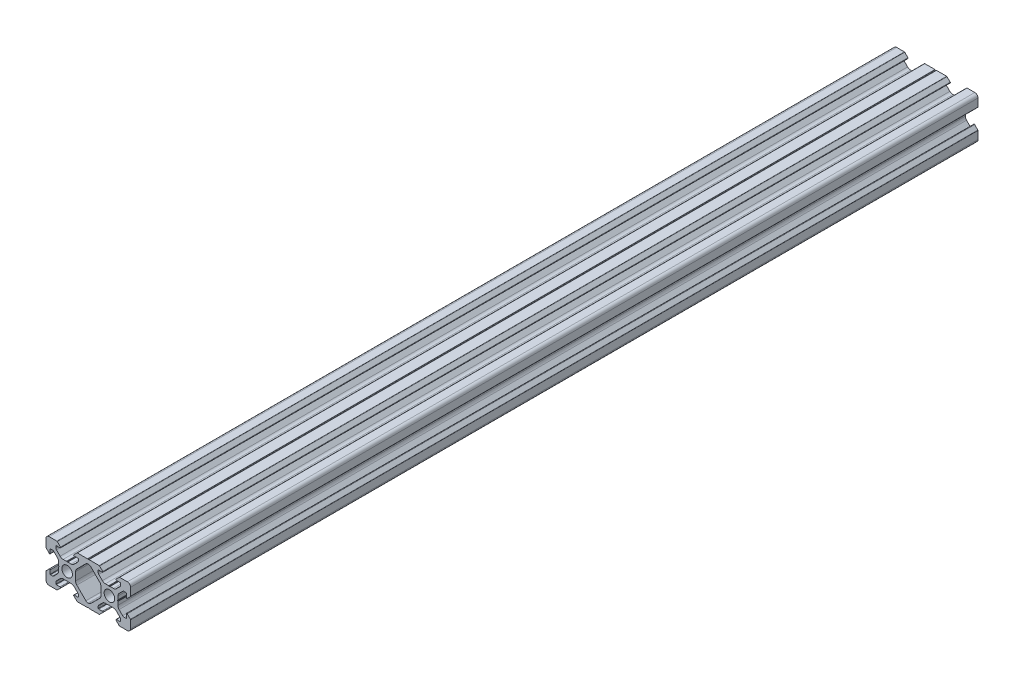
from build123d import *

# Parameters (mm, degrees)
MODEL_R                         = 2.5
BODY_DEPTH                      = 401
TAP_DRILL_FOR_M6X1_0_TAP1_D     = 5
TAP_DRILL_FOR_M6X1_0_TAP1_DEPTH = 13.497848452
TAP_DRILL_FOR_M6X1_0_TAP1_TIP   = 1.502151548
TAP_DRILL_FOR_M6X1_0_TAP2_D     = 5
TAP_DRILL_FOR_M6X1_0_TAP2_DEPTH = 13.497848452
TAP_DRILL_FOR_M6X1_0_TAP2_TIP   = 1.502151548


with BuildPart() as part:
    # Model → Body (new body)
    with BuildSketch(Plane.XY):
        with BuildLine():
            Line((0.375693909, 9.662304735), (5.17, 9.662304735))
            ThreePointArc((5.17, 9.662304735), (5.265670858, 9.643274618), (5.346776695, 9.58908143))
            Line((5.346776695, 9.58908143), (6.846776695, 8.08908143))
            ThreePointArc((6.846776695, 8.08908143), (6.900969883, 7.816633877), (6.67, 7.662304735))
            Line((6.67, 7.662304735), (4.9, 7.662304735))
            ThreePointArc((4.9, 7.662304735), (4.758578644, 7.603726091), (4.7, 7.462304735))
            Line((4.7, 7.462304735), (4.7, 6.649310504))
            ThreePointArc((4.7, 6.649310504), (4.776120467, 6.266627071), (4.992893219, 5.942203722))
            Line((4.992893219, 5.942203722), (6.687005769, 4.248091173))
            ThreePointArc((6.687005769, 4.248091173), (7.335852466, 3.81454567), (8.101219331, 3.662304735))
            Line((8.101219331, 3.662304735), (9.662304735, 3.662304735))
            ThreePointArc((9.662304735, 3.662304735), (9.745056471, 3.648211815), (9.818478497, 3.607521938))
            Line((9.818478497, 3.607521938), (10, 3.462304735))
            Line((10, 3.462304735), (10.181521503, 3.607521938))
            ThreePointArc((10.181521503, 3.607521938), (10.254943529, 3.648211815), (10.337695265, 3.662304735))
            Line((10.337695265, 3.662304735), (11.898780669, 3.662304735))
            ThreePointArc((11.898780669, 3.662304735), (12.664147534, 3.81454567), (13.312994231, 4.248091173))
            Line((13.312994231, 4.248091173), (15.007106781, 5.942203722))
            ThreePointArc((15.007106781, 5.942203722), (15.223879533, 6.266627071), (15.3, 6.649310504))
            Line((15.3, 6.649310504), (15.3, 7.462304735))
            ThreePointArc((15.3, 7.462304735), (15.241421356, 7.603726091), (15.1, 7.662304735))
            Line((15.1, 7.662304735), (13.33, 7.662304735))
            ThreePointArc((13.33, 7.662304735), (13.099030117, 7.816633877), (13.153223305, 8.08908143))
            Line((13.153223305, 8.08908143), (14.653223305, 9.58908143))
            ThreePointArc((14.653223305, 9.58908143), (14.734329142, 9.643274618), (14.83, 9.662304735))
            Line((14.83, 9.662304735), (18.5, 9.662304735))
            ThreePointArc((18.5, 9.662304735), (19.560660172, 9.222964907), (20, 8.162304735))
            Line((20, 8.162304735), (20, 4.492304735))
            ThreePointArc((20, 4.492304735), (19.980969883, 4.396633877), (19.926776695, 4.31552804))
            Line((19.926776695, 4.31552804), (18.426776695, 2.81552804))
            ThreePointArc((18.426776695, 2.81552804), (18.154329142, 2.761334852), (18, 2.992304735))
            Line((18, 2.992304735), (18, 4.762304735))
            ThreePointArc((18, 4.762304735), (17.941421356, 4.903726091), (17.8, 4.962304735))
            Line((17.8, 4.962304735), (16.987005769, 4.962304735))
            ThreePointArc((16.987005769, 4.962304735), (16.604322336, 4.886184268), (16.279898987, 4.669411516))
            Line((16.279898987, 4.669411516), (14.585786438, 2.975298967))
            ThreePointArc((14.585786438, 2.975298967), (14.152240935, 2.326452269), (14, 1.561085404))
            Line((14, 1.561085404), (14, 0))
            ThreePointArc((14, 0), (13.98590708, -0.082751735), (13.945217202, -0.156173762))
            Line((13.945217202, -0.156173762), (13.8, -0.337695265))
            Line((13.8, -0.337695265), (13.945217202, -0.519216768))
            ThreePointArc((13.945217202, -0.519216768), (13.98590708, -0.592638794), (14, -0.67539053))
            Line((14, -0.67539053), (14, -2.236475934))
            ThreePointArc((14, -2.236475934), (14.152240935, -3.001842799), (14.585786438, -3.650689496))
            Line((14.585786438, -3.650689496), (16.279898987, -5.344802046))
            ThreePointArc((16.279898987, -5.344802046), (16.604322336, -5.561574797), (16.987005769, -5.637695265))
            Line((16.987005769, -5.637695265), (17.8, -5.637695265))
            ThreePointArc((17.8, -5.637695265), (17.941421356, -5.579116621), (18, -5.437695265))
            Line((18, -5.437695265), (18, -3.667695265))
            ThreePointArc((18, -3.667695265), (18.154329142, -3.436725382), (18.426776695, -3.49091857))
            Line((18.426776695, -3.49091857), (19.926776695, -4.99091857))
            ThreePointArc((19.926776695, -4.99091857), (19.980969883, -5.072024407), (20, -5.167695265))
            Line((20, -5.167695265), (20, -8.837695265))
            ThreePointArc((20, -8.837695265), (19.560660172, -9.898355437), (18.5, -10.337695265))
            Line((18.5, -10.337695265), (14.83, -10.337695265))
            ThreePointArc((14.83, -10.337695265), (14.734329142, -10.318665148), (14.653223305, -10.26447196))
            Line((14.653223305, -10.26447196), (13.153223305, -8.76447196))
            ThreePointArc((13.153223305, -8.76447196), (13.099030117, -8.492024407), (13.33, -8.337695265))
            Line((13.33, -8.337695265), (15.1, -8.337695265))
            ThreePointArc((15.1, -8.337695265), (15.241421356, -8.279116621), (15.3, -8.137695265))
            Line((15.3, -8.137695265), (15.3, -7.324701033))
            ThreePointArc((15.3, -7.324701033), (15.223879533, -6.942017601), (15.007106781, -6.617594252))
            Line((15.007106781, -6.617594252), (13.312994231, -4.923481702))
            ThreePointArc((13.312994231, -4.923481702), (12.664147534, -4.4899362), (11.898780669, -4.337695265))
            Line((11.898780669, -4.337695265), (10.337695265, -4.337695265))
            ThreePointArc((10.337695265, -4.337695265), (10.254943529, -4.323602345), (10.181521503, -4.282912467))
            Line((10.181521503, -4.282912467), (10, -4.137695265))
            Line((10, -4.137695265), (9.818478497, -4.282912467))
            ThreePointArc((9.818478497, -4.282912467), (9.745056471, -4.323602345), (9.662304735, -4.337695265))
            Line((9.662304735, -4.337695265), (8.101219331, -4.337695265))
            ThreePointArc((8.101219331, -4.337695265), (7.335852466, -4.4899362), (6.687005769, -4.923481702))
            Line((6.687005769, -4.923481702), (4.992893219, -6.617594252))
            ThreePointArc((4.992893219, -6.617594252), (4.776120467, -6.942017601), (4.7, -7.324701033))
            Line((4.7, -7.324701033), (4.7, -8.137695265))
            ThreePointArc((4.7, -8.137695265), (4.758578644, -8.279116621), (4.9, -8.337695265))
            Line((4.9, -8.337695265), (6.67, -8.337695265))
            ThreePointArc((6.67, -8.337695265), (6.900969883, -8.492024407), (6.846776695, -8.76447196))
            Line((6.846776695, -8.76447196), (5.346776695, -10.26447196))
            ThreePointArc((5.346776695, -10.26447196), (5.265670858, -10.318665148), (5.17, -10.337695265))
            Line((5.17, -10.337695265), (0.375693909, -10.337695265))
            ThreePointArc((0.375693909, -10.337695265), (0.303247872, -10.326968271), (0.23701886, -10.295707838))
            Line((0.23701886, -10.295707838), (0, -10.137695265))
            Line((0, -10.137695265), (-0.23701886, -10.295707838))
            ThreePointArc((-0.23701886, -10.295707838), (-0.303247872, -10.326968271), (-0.375693909, -10.337695265))
            Line((-0.375693909, -10.337695265), (-5.17, -10.337695265))
            ThreePointArc((-5.17, -10.337695265), (-5.265670858, -10.318665148), (-5.346776695, -10.26447196))
            Line((-5.346776695, -10.26447196), (-6.846776695, -8.76447196))
            ThreePointArc((-6.846776695, -8.76447196), (-6.900969883, -8.492024407), (-6.67, -8.337695265))
            Line((-6.67, -8.337695265), (-4.9, -8.337695265))
            ThreePointArc((-4.9, -8.337695265), (-4.758578644, -8.279116621), (-4.7, -8.137695265))
            Line((-4.7, -8.137695265), (-4.7, -7.324701033))
            ThreePointArc((-4.7, -7.324701033), (-4.776120467, -6.942017601), (-4.992893219, -6.617594252))
            Line((-4.992893219, -6.617594252), (-6.687005769, -4.923481702))
            ThreePointArc((-6.687005769, -4.923481702), (-7.335852466, -4.4899362), (-8.101219331, -4.337695265))
            Line((-8.101219331, -4.337695265), (-9.662304735, -4.337695265))
            ThreePointArc((-9.662304735, -4.337695265), (-9.745056471, -4.323602345), (-9.818478497, -4.282912467))
            Line((-9.818478497, -4.282912467), (-10, -4.137695265))
            Line((-10, -4.137695265), (-10.181521503, -4.282912467))
            ThreePointArc((-10.181521503, -4.282912467), (-10.254943529, -4.323602345), (-10.337695265, -4.337695265))
            Line((-10.337695265, -4.337695265), (-11.898780669, -4.337695265))
            ThreePointArc((-11.898780669, -4.337695265), (-12.664147534, -4.4899362), (-13.312994231, -4.923481702))
            Line((-13.312994231, -4.923481702), (-15.007106781, -6.617594252))
            ThreePointArc((-15.007106781, -6.617594252), (-15.223879533, -6.942017601), (-15.3, -7.324701033))
            Line((-15.3, -7.324701033), (-15.3, -8.137695265))
            ThreePointArc((-15.3, -8.137695265), (-15.241421356, -8.279116621), (-15.1, -8.337695265))
            Line((-15.1, -8.337695265), (-13.33, -8.337695265))
            ThreePointArc((-13.33, -8.337695265), (-13.099030117, -8.492024407), (-13.153223305, -8.76447196))
            Line((-13.153223305, -8.76447196), (-14.653223305, -10.26447196))
            ThreePointArc((-14.653223305, -10.26447196), (-14.734329142, -10.318665148), (-14.83, -10.337695265))
            Line((-14.83, -10.337695265), (-18.5, -10.337695265))
            ThreePointArc((-18.5, -10.337695265), (-19.560660172, -9.898355437), (-20, -8.837695265))
            Line((-20, -8.837695265), (-20, -5.167695265))
            ThreePointArc((-20, -5.167695265), (-19.980969883, -5.072024407), (-19.926776695, -4.99091857))
            Line((-19.926776695, -4.99091857), (-18.426776695, -3.49091857))
            ThreePointArc((-18.426776695, -3.49091857), (-18.154329142, -3.436725382), (-18, -3.667695265))
            Line((-18, -3.667695265), (-18, -5.437695265))
            ThreePointArc((-18, -5.437695265), (-17.941421356, -5.579116621), (-17.8, -5.637695265))
            Line((-17.8, -5.637695265), (-16.987005769, -5.637695265))
            ThreePointArc((-16.987005769, -5.637695265), (-16.604322336, -5.561574797), (-16.279898987, -5.344802046))
            Line((-16.279898987, -5.344802046), (-14.585786438, -3.650689496))
            ThreePointArc((-14.585786438, -3.650689496), (-14.152240935, -3.001842799), (-14, -2.236475934))
            Line((-14, -2.236475934), (-14, -0.67539053))
            ThreePointArc((-14, -0.67539053), (-13.98590708, -0.592638794), (-13.945217202, -0.519216768))
            Line((-13.945217202, -0.519216768), (-13.8, -0.337695265))
            Line((-13.8, -0.337695265), (-13.945217202, -0.156173762))
            ThreePointArc((-13.945217202, -0.156173762), (-13.98590708, -0.082751735), (-14, 0))
            Line((-14, 0), (-14, 1.561085404))
            ThreePointArc((-14, 1.561085404), (-14.152240935, 2.326452269), (-14.585786438, 2.975298967))
            Line((-14.585786438, 2.975298967), (-16.279898987, 4.669411516))
            ThreePointArc((-16.279898987, 4.669411516), (-16.604322336, 4.886184268), (-16.987005769, 4.962304735))
            Line((-16.987005769, 4.962304735), (-17.8, 4.962304735))
            ThreePointArc((-17.8, 4.962304735), (-17.941421356, 4.903726091), (-18, 4.762304735))
            Line((-18, 4.762304735), (-18, 2.992304735))
            ThreePointArc((-18, 2.992304735), (-18.154329142, 2.761334852), (-18.426776695, 2.81552804))
            Line((-18.426776695, 2.81552804), (-19.926776695, 4.31552804))
            ThreePointArc((-19.926776695, 4.31552804), (-19.980969883, 4.396633877), (-20, 4.492304735))
            Line((-20, 4.492304735), (-20, 8.162304735))
            ThreePointArc((-20, 8.162304735), (-19.560660172, 9.222964907), (-18.5, 9.662304735))
            Line((-18.5, 9.662304735), (-14.83, 9.662304735))
            ThreePointArc((-14.83, 9.662304735), (-14.734329142, 9.643274618), (-14.653223305, 9.58908143))
            Line((-14.653223305, 9.58908143), (-13.153223305, 8.08908143))
            ThreePointArc((-13.153223305, 8.08908143), (-13.099030117, 7.816633877), (-13.33, 7.662304735))
            Line((-13.33, 7.662304735), (-15.1, 7.662304735))
            ThreePointArc((-15.1, 7.662304735), (-15.241421356, 7.603726091), (-15.3, 7.462304735))
            Line((-15.3, 7.462304735), (-15.3, 6.649310504))
            ThreePointArc((-15.3, 6.649310504), (-15.223879533, 6.266627071), (-15.007106781, 5.942203722))
            Line((-15.007106781, 5.942203722), (-13.312994231, 4.248091173))
            ThreePointArc((-13.312994231, 4.248091173), (-12.664147534, 3.81454567), (-11.898780669, 3.662304735))
            Line((-11.898780669, 3.662304735), (-10.337695265, 3.662304735))
            ThreePointArc((-10.337695265, 3.662304735), (-10.254943529, 3.648211815), (-10.181521503, 3.607521938))
            Line((-10.181521503, 3.607521938), (-10, 3.462304735))
            Line((-10, 3.462304735), (-9.818478497, 3.607521938))
            ThreePointArc((-9.818478497, 3.607521938), (-9.745056471, 3.648211815), (-9.662304735, 3.662304735))
            Line((-9.662304735, 3.662304735), (-8.101219331, 3.662304735))
            ThreePointArc((-8.101219331, 3.662304735), (-7.335852466, 3.81454567), (-6.687005769, 4.248091173))
            Line((-6.687005769, 4.248091173), (-4.992893219, 5.942203722))
            ThreePointArc((-4.992893219, 5.942203722), (-4.776120467, 6.266627071), (-4.7, 6.649310504))
            Line((-4.7, 6.649310504), (-4.7, 7.462304735))
            ThreePointArc((-4.7, 7.462304735), (-4.758578644, 7.603726091), (-4.9, 7.662304735))
            Line((-4.9, 7.662304735), (-6.67, 7.662304735))
            ThreePointArc((-6.67, 7.662304735), (-6.900969883, 7.816633877), (-6.846776695, 8.08908143))
            Line((-6.846776695, 8.08908143), (-5.346776695, 9.58908143))
            ThreePointArc((-5.346776695, 9.58908143), (-5.265670858, 9.643274618), (-5.17, 9.662304735))
            Line((-5.17, 9.662304735), (-0.375693909, 9.662304735))
            ThreePointArc((-0.375693909, 9.662304735), (-0.303247872, 9.651577742), (-0.23701886, 9.620317309))
            Line((-0.23701886, 9.620317309), (0, 9.462304735))
            Line((0, 9.462304735), (0.23701886, 9.620317309))
            ThreePointArc((0.23701886, 9.620317309), (0.303247872, 9.651577742), (0.375693909, 9.662304735))
        make_face()
        with Locations((10, -0.337695265)):
            Circle(MODEL_R, mode=Mode.SUBTRACT)
        with Locations((-10, -0.337695265)):
            Circle(MODEL_R, mode=Mode.SUBTRACT)
        with BuildLine():
            Line((-5.414213562, 2.975298967), (-1.1372583, 7.252254229))
            ThreePointArc((-1.1372583, 7.252254229), (-0.683065612, 7.555736081), (-0.147308807, 7.662304735))
            Line((-0.147308807, 7.662304735), (0.147308807, 7.662304735))
            ThreePointArc((0.147308807, 7.662304735), (0.683065612, 7.555736081), (1.1372583, 7.252254229))
            Line((1.1372583, 7.252254229), (5.414213562, 2.975298967))
            ThreePointArc((5.414213562, 2.975298967), (5.847759065, 2.326452269), (6, 1.561085404))
            Line((6, 1.561085404), (6, -2.236475934))
            ThreePointArc((6, -2.236475934), (5.847759065, -3.001842799), (5.414213562, -3.650689496))
            Line((5.414213562, -3.650689496), (1.1372583, -7.927644759))
            ThreePointArc((1.1372583, -7.927644759), (0.683065612, -8.23112661), (0.147308807, -8.337695265))
            Line((0.147308807, -8.337695265), (-0.147308807, -8.337695265))
            ThreePointArc((-0.147308807, -8.337695265), (-0.683065612, -8.23112661), (-1.1372583, -7.927644759))
            Line((-1.1372583, -7.927644759), (-5.414213562, -3.650689496))
            ThreePointArc((-5.414213562, -3.650689496), (-5.847759065, -3.001842799), (-6, -2.236475934))
            Line((-6, -2.236475934), (-6, 1.561085404))
            ThreePointArc((-6, 1.561085404), (-5.847759065, 2.326452269), (-5.414213562, 2.975298967))
        make_face(mode=Mode.SUBTRACT)
    extrude(amount=BODY_DEPTH)

    # Tap Drill for M6x1.0 Tap1
    with Locations(Plane.XY.offset(401)):
        with Locations((-10, -0.337695265), (10, -0.337695265)):
            Hole(TAP_DRILL_FOR_M6X1_0_TAP1_D / 2, depth=TAP_DRILL_FOR_M6X1_0_TAP1_DEPTH)
            with Locations((0, 0, -(TAP_DRILL_FOR_M6X1_0_TAP1_DEPTH + TAP_DRILL_FOR_M6X1_0_TAP1_TIP / 2))):  # 118° drill point
                Cone(0, TAP_DRILL_FOR_M6X1_0_TAP1_D / 2, TAP_DRILL_FOR_M6X1_0_TAP1_TIP, mode=Mode.SUBTRACT)

    # Tap Drill for M6x1.0 Tap2
    with Locations(Plane(origin=(0, 0, 0), x_dir=(-1, 0, 0), z_dir=(0, 0, -1))):
        with Locations((-10, -0.337695265), (10, -0.337695265)):
            Hole(TAP_DRILL_FOR_M6X1_0_TAP2_D / 2, depth=TAP_DRILL_FOR_M6X1_0_TAP2_DEPTH)
            with Locations((0, 0, -(TAP_DRILL_FOR_M6X1_0_TAP2_DEPTH + TAP_DRILL_FOR_M6X1_0_TAP2_TIP / 2))):  # 118° drill point
                Cone(0, TAP_DRILL_FOR_M6X1_0_TAP2_D / 2, TAP_DRILL_FOR_M6X1_0_TAP2_TIP, mode=Mode.SUBTRACT)


solid = part.part
